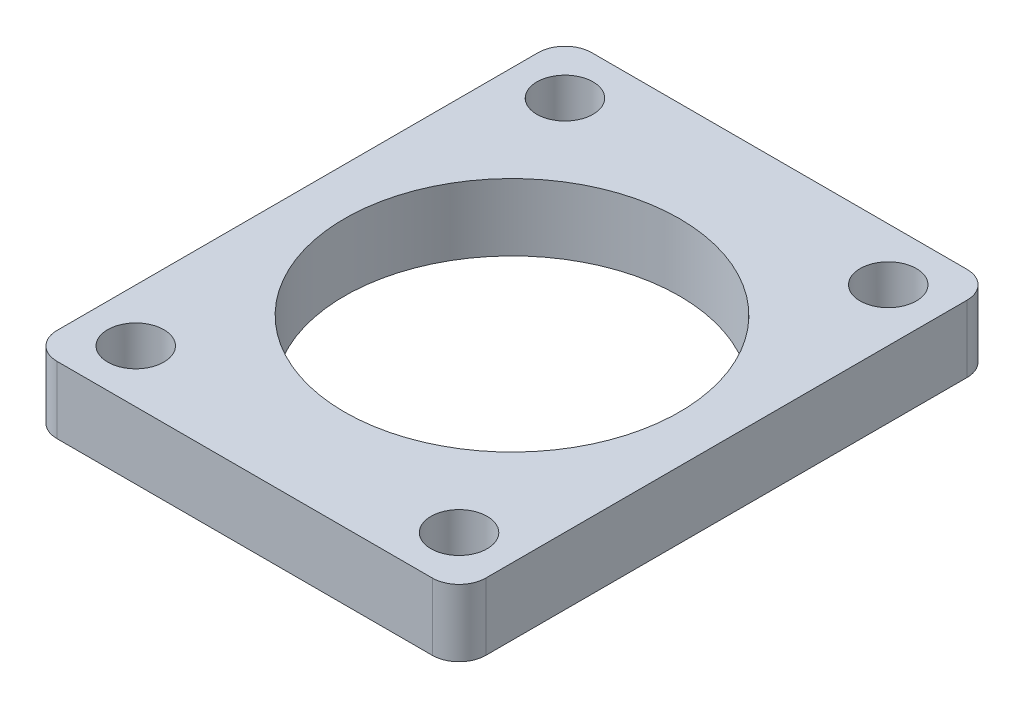
from build123d import *

# Parameters (mm, degrees)
SKETCH1_W           = 40.64
SKETCH1_H           = 50.673
SKETCH1_R           = 15.875
BOSS_EXTRUDE1_DEPTH = 6.35
CUT_EXTRUDE1_REACH  = 35.093
SKETCH2_R           = 2.665
FILLET1_R           = 2.54


with BuildPart() as part:
    # Sketch1 → Boss-Extrude1 (new body)
    with BuildSketch(Plane(origin=(0, 0, 0), x_dir=(1, 0, 0), z_dir=(0, 1, 0))):
        Rectangle(SKETCH1_W, SKETCH1_H)
        Circle(SKETCH1_R, mode=Mode.SUBTRACT)
    extrude(amount=BOSS_EXTRUDE1_DEPTH)

    # Sketch2 → Cut-Extrude1 (cut, up to next)
    with BuildSketch(Plane(origin=(0, 6.35, 0), x_dir=(1, 0, 0), z_dir=(0, 1, 0)), mode=Mode.PRIVATE) as cut_extrude1_sk1:
        with Locations((-15.32, 20.3365)):
            Circle(SKETCH2_R)
    cut_extrude1_tool1 = extrude(cut_extrude1_sk1.sketch, amount=-CUT_EXTRUDE1_REACH, mode=Mode.PRIVATE) & part.part
    # Sketch2 → Cut-Extrude1 (cut, up to next)
    with BuildSketch(Plane(origin=(0, 6.35, 0), x_dir=(1, 0, 0), z_dir=(0, 1, 0)), mode=Mode.PRIVATE) as cut_extrude1_sk2:
        with Locations((15.32, 20.3365)):
            Circle(SKETCH2_R)
    cut_extrude1_tool2 = extrude(cut_extrude1_sk2.sketch, amount=-CUT_EXTRUDE1_REACH, mode=Mode.PRIVATE) & part.part
    # Sketch2 → Cut-Extrude1 (cut, up to next)
    with BuildSketch(Plane(origin=(0, 6.35, 0), x_dir=(1, 0, 0), z_dir=(0, 1, 0)), mode=Mode.PRIVATE) as cut_extrude1_sk3:
        with Locations((15.32, -20.3365)):
            Circle(SKETCH2_R)
    cut_extrude1_tool3 = extrude(cut_extrude1_sk3.sketch, amount=-CUT_EXTRUDE1_REACH, mode=Mode.PRIVATE) & part.part
    # Sketch2 → Cut-Extrude1 (cut, up to next)
    with BuildSketch(Plane(origin=(0, 6.35, 0), x_dir=(1, 0, 0), z_dir=(0, 1, 0)), mode=Mode.PRIVATE) as cut_extrude1_sk4:
        with Locations((-15.32, -20.3365)):
            Circle(SKETCH2_R)
    cut_extrude1_tool4 = extrude(cut_extrude1_sk4.sketch, amount=-CUT_EXTRUDE1_REACH, mode=Mode.PRIVATE) & part.part
    add(cut_extrude1_tool1.solids().sort_by_distance((-15.32, 6.35, -20.3365))[0], mode=Mode.SUBTRACT)
    add(cut_extrude1_tool2.solids().sort_by_distance((15.32, 6.35, -20.3365))[0], mode=Mode.SUBTRACT)
    add(cut_extrude1_tool3.solids().sort_by_distance((15.32, 6.35, 20.3365))[0], mode=Mode.SUBTRACT)
    add(cut_extrude1_tool4.solids().sort_by_distance((-15.32, 6.35, 20.3365))[0], mode=Mode.SUBTRACT)

    # Fillet1
    fillet1_edges = [part.edges().sort_by_distance(p)[0] for p in [
        (20.32, 3.175, -25.3365),
        (-20.32, 3.175, -25.3365),
        (20.32, 3.175, 25.3365),
        (-20.32, 3.175, 25.3365),
    ]]
    fillet(fillet1_edges, radius=FILLET1_R)


solid = part.part
